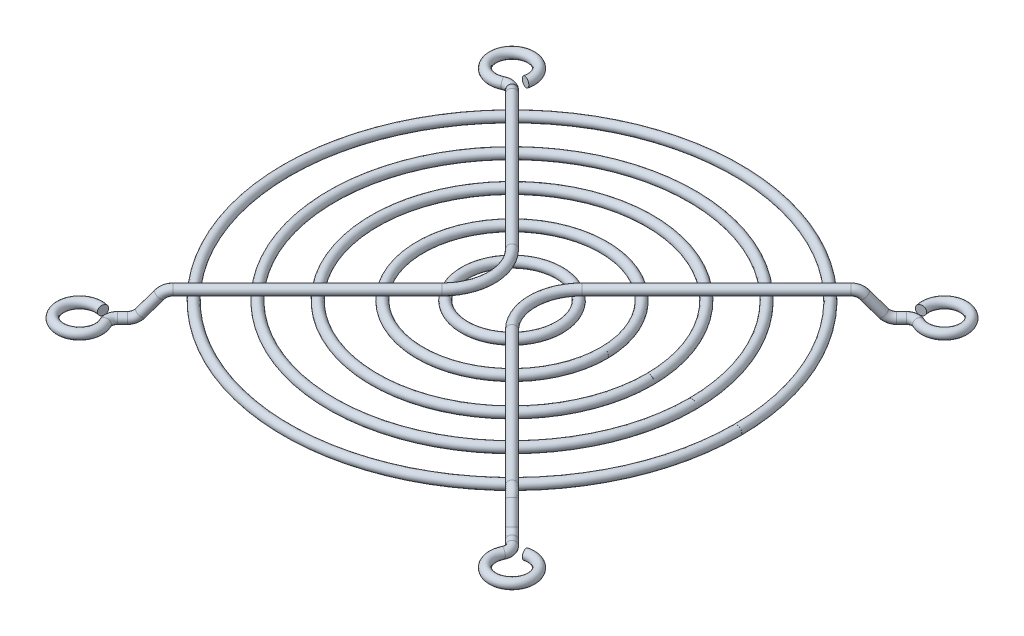
from build123d import *

# Parameters (mm, degrees)
BALAYAGE2_OUTLINE_R = 0.75
BALAYAGE2_ANGLE     = 359.984281
ESQUISSE4_R         = 0.75
ESQUISSE5_R         = 0.75
ESQUISSE7_R         = 0.75
ESQUISSE8_R         = 0.75
ESQUISSE11_R        = 0.75
ESQUISSE13_R        = 0.75
ESQUISSE19_R        = 0.75
ESQUISSE15_R        = 0.75
ESQUISSE20_R        = 0.75
ESQUISSE21_R        = 0.75
ESCALA2_SCALE       = 2


# Read off the part's stored shape, not the designer's step: Balayage2
with BuildPart() as part:
    # Balayage2 outline → Balayage2 (revolve)
    with BuildSketch(Plane.XY):
        with Locations((36.45, 0)):
            Circle(BALAYAGE2_OUTLINE_R)
        with Locations((29.15, 0)):
            Circle(BALAYAGE2_OUTLINE_R)
        with Locations((22.25, 0)):
            Circle(BALAYAGE2_OUTLINE_R)
        with Locations((14.85, 0)):
            Circle(BALAYAGE2_OUTLINE_R)
        with Locations((7.65, 0)):
            Circle(BALAYAGE2_OUTLINE_R)
    revolve(axis=Axis((0, 0, 0), (0, 1, 0)), revolution_arc=BALAYAGE2_ANGLE)


with BuildPart() as body_2:
    # Balayage3: sweep along a path in Esquisse3
    with BuildLine(Plane(origin=(0, 1.5, 0), x_dir=(-1, 0, 0), z_dir=(0, 1, 0))) as balayage3_path:
        Line((-27, -27), (-5.656854249, -5.656854249))
        ThreePointArc((-5.656854249, -5.656854249), (-3.313708499, 0), (-5.656854249, 5.656854249))
        Line((-5.656854249, 5.656854249), (-27, 27))
    # Esquisse4 → Balayage3 (sweep)
    with BuildSketch(Plane(origin=(27, 0, -27), x_dir=(-0.7071067811865488, 0, -0.7071067811865462), z_dir=(0.7071067811865462, 0, -0.7071067811865488))):
        with Locations((0, 1.5)):
            Circle(ESQUISSE4_R)
    sweep(path=balayage3_path.line)

    # Balayage14: sweep along a path in Esquisse9
    with BuildLine(Plane(origin=(0, 0, 0), x_dir=(0.7071067811865488, 0, -0.7071067811865462), z_dir=(0.7071067811865462, 0, 0.7071067811865488))) as balayage14_path:
        Line((38.183766184, 1.5), (38.822951605, 1.5))
        ThreePointArc((38.822951605, 1.5), (39.668188129, 1.312615574), (40.355040492, 0.785575219))
        Line((40.355040492, 0.785575219), (42.512491877, -1.785575219))
        ThreePointArc((42.512491877, -1.785575219), (43.199344239, -2.312615574), (44.044580763, -2.5))
        Line((44.044580763, -2.5), (44.683766184, -2.5))
    # Esquisse8 → Balayage14 (sweep)
    with BuildSketch(Plane(origin=(27, 0, -27), x_dir=(-0.7071067811865488, 0, -0.7071067811865462), z_dir=(0.7071067811865462, 0, -0.7071067811865488))):
        with Locations((0, 1.5)):
            Circle(ESQUISSE8_R)
    sweep(path=balayage14_path.line)

    # Balayage16: sweep along a path in Esquisse12
    with BuildLine(Plane(origin=(0, 0, 0), x_dir=(-0.7071067811865488, 0, -0.7071067811865462), z_dir=(0.7071067811865462, 0, -0.7071067811865488))) as balayage16_path:
        Line((-38.183766184, 1.5), (-38.822951605, 1.5))
        ThreePointArc((-38.822951605, 1.5), (-39.668188129, 1.312615574), (-40.355040492, 0.785575219))
        Line((-40.355040492, 0.785575219), (-42.512491877, -1.785575219))
        ThreePointArc((-42.512491877, -1.785575219), (-43.199344239, -2.312615574), (-44.044580763, -2.5))
        Line((-44.044580763, -2.5), (-44.683766184, -2.5))
    # Esquisse13 → Balayage16 (sweep)
    with BuildSketch(Plane(origin=(27, 0, 27), x_dir=(0.7071067811865457, 0, -0.7071067811865495), z_dir=(0.7071067811865495, 0, 0.7071067811865457))):
        with Locations((0, 1.5)):
            Circle(ESQUISSE13_R)
    sweep(path=balayage16_path.line)

    # Balayage18: sweep along a path in Esquisse16
    with BuildLine(Plane(origin=(0, -2.5, 0), x_dir=(-1, 0, 0), z_dir=(0, 1, 0))) as balayage18_path:
        Line((-31.596194078, 31.596194078), (-31.925101628, 31.925101628))
        ThreePointArc((-31.925101628, 31.925101628), (-32.343801875, 32.737784484), (-32.212993155, 33.642578604))
        ThreePointArc((-32.212993155, 33.642578604), (-36.972498721, 37.391495096), (-34.19766096, 32.005629939))
    # Esquisse19 → Balayage18 (sweep)
    with BuildSketch(Plane(origin=(31.596194078, 0, 31.596194078), x_dir=(0.7071067811865456, 0, -0.7071067811865495), z_dir=(0.7071067811865495, 0, 0.7071067811865456))):
        with Locations((0, -2.5)):
            Circle(ESQUISSE19_R)
    sweep(path=balayage18_path.line)

    # Balayage20: sweep along a path in Esquisse17
    with BuildLine(Plane(origin=(0, -2.5, 0), x_dir=(-1, 0, 0), z_dir=(0, 1, 0))) as balayage20_path:
        Line((-31.596194078, -31.596194078), (-31.925101628, -31.925101628))
        ThreePointArc((-31.925101628, -31.925101628), (-32.737784484, -32.343801875), (-33.642578604, -32.212993155))
        ThreePointArc((-33.642578604, -32.212993155), (-37.391495096, -36.972498721), (-32.005629939, -34.19766096))
    # Esquisse20 → Balayage20 (sweep)
    with BuildSketch(Plane(origin=(31.596194078, 0, -31.596194078), x_dir=(-0.7071067811865488, 0, -0.7071067811865462), z_dir=(0.7071067811865462, 0, -0.7071067811865488))):
        with Locations((0, -2.5)):
            Circle(ESQUISSE20_R)
    sweep(path=balayage20_path.line)


with BuildPart() as body_3:
    # Balayage6: sweep along a path in Esquisse3<5>
    with BuildLine(Plane(origin=(0, 1.5, 0), x_dir=(-1, 0, 0), z_dir=(0, 1, 0))) as balayage6_path:
        Line((27, 27), (5.656854249, 5.656854249))
        ThreePointArc((5.656854249, 5.656854249), (3.313708499, 0), (5.656854249, -5.656854249))
        Line((5.656854249, -5.656854249), (27, -27))
    # Esquisse5 → Balayage6 (sweep)
    with BuildSketch(Plane(origin=(-27, 0, -27), x_dir=(0.7071067811865488, 0, -0.7071067811865462), z_dir=(0.7071067811865462, 0, 0.7071067811865488))):
        with Locations((0, 1.5)):
            Circle(ESQUISSE5_R)
    sweep(path=balayage6_path.line)

    # Balayage8: sweep along a path in Esquisse6
    with BuildLine(Plane(origin=(0, 0, 0), x_dir=(0.7071067811865488, 0, -0.7071067811865462), z_dir=(0.7071067811865462, 0, 0.7071067811865488))) as balayage8_path:
        Line((-38.183766184, 1.5), (-38.822951605, 1.5))
        ThreePointArc((-38.822951605, 1.5), (-39.668188129, 1.312615574), (-40.355040492, 0.785575219))
        Line((-40.355040492, 0.785575219), (-42.512491877, -1.785575219))
        ThreePointArc((-42.512491877, -1.785575219), (-43.199344239, -2.312615574), (-44.044580763, -2.5))
        Line((-44.044580763, -2.5), (-44.683766184, -2.5))
    # Esquisse7 → Balayage8 (sweep)
    with BuildSketch(Plane(origin=(-27, 0, 27), x_dir=(0.7071067811865449, 0, 0.7071067811865502), z_dir=(-0.7071067811865502, 0, 0.7071067811865449))):
        with Locations((0, 1.5)):
            Circle(ESQUISSE7_R)
    sweep(path=balayage8_path.line)

    # Balayage15: sweep along a path in Esquisse10
    with BuildLine(Plane(origin=(0, 0, 0), x_dir=(-0.7071067811865488, 0, -0.7071067811865462), z_dir=(0.7071067811865462, 0, -0.7071067811865488))) as balayage15_path:
        Line((38.183766184, 1.5), (38.822951605, 1.5))
        ThreePointArc((38.822951605, 1.5), (39.668188129, 1.312615574), (40.355040492, 0.785575219))
        Line((40.355040492, 0.785575219), (42.512491877, -1.785575219))
        ThreePointArc((42.512491877, -1.785575219), (43.199344239, -2.312615574), (44.044580763, -2.5))
        Line((44.044580763, -2.5), (44.683766184, -2.5))
    # Esquisse11 → Balayage15 (sweep)
    with BuildSketch(Plane(origin=(-27, 0, -27), x_dir=(-0.7071067811865488, 0, 0.7071067811865462), z_dir=(-0.7071067811865462, 0, -0.7071067811865488))):
        with Locations((0, 1.5)):
            Circle(ESQUISSE11_R)
    sweep(path=balayage15_path.line)

    # Balayage19: sweep along a path in Esquisse14
    with BuildLine(Plane(origin=(0, -2.5, 0), x_dir=(-1, 0, 0), z_dir=(0, 1, 0))) as balayage19_path:
        Line((31.596194078, 31.596194078), (31.925101628, 31.925101628))
        ThreePointArc((31.925101628, 31.925101628), (32.343801875, 32.737784484), (32.212993155, 33.642578604))
        ThreePointArc((32.212993155, 33.642578604), (36.972498721, 37.391495096), (34.19766096, 32.005629939))
    # Esquisse15 → Balayage19 (sweep)
    with BuildSketch(Plane(origin=(-31.596194078, 0, 31.596194078), x_dir=(0.7071067811865449, 0, 0.7071067811865501), z_dir=(-0.7071067811865501, 0, 0.7071067811865449))):
        with Locations((0, -2.5)):
            Circle(ESQUISSE15_R)
    sweep(path=balayage19_path.line)

    # Balayage21: sweep along a path in Esquisse18
    with BuildLine(Plane(origin=(0, -2.5, 0), x_dir=(-1, 0, 0), z_dir=(0, 1, 0))) as balayage21_path:
        Line((31.596194078, -31.596194078), (31.925101628, -31.925101628))
        ThreePointArc((31.925101628, -31.925101628), (32.737784484, -32.343801875), (33.642578604, -32.212993155))
        ThreePointArc((33.642578604, -32.212993155), (37.391495096, -36.972498721), (32.005629939, -34.19766096))
    # Esquisse21 → Balayage21 (sweep)
    with BuildSketch(Plane(origin=(-31.596194078, 0, -31.596194078), x_dir=(-0.7071067811865488, 0, 0.7071067811865462), z_dir=(-0.7071067811865462, 0, -0.7071067811865488))):
        with Locations((0, -2.5)):
            Circle(ESQUISSE21_R)
    sweep(path=balayage21_path.line)


with BuildPart() as part_1:
    # Escala2: scaled about (0, 0, 0)
    add(part.part.scale(ESCALA2_SCALE))


with BuildPart() as body_3_1:
    # Escala2: scaled about (0, 0, 0)
    add(body_3.part.scale(ESCALA2_SCALE))


with BuildPart() as body_2_1:
    # Escala2: scaled about (0, 0, 0)
    add(body_2.part.scale(ESCALA2_SCALE))


solid = Compound([part_1.part, body_3_1.part, body_2_1.part])
